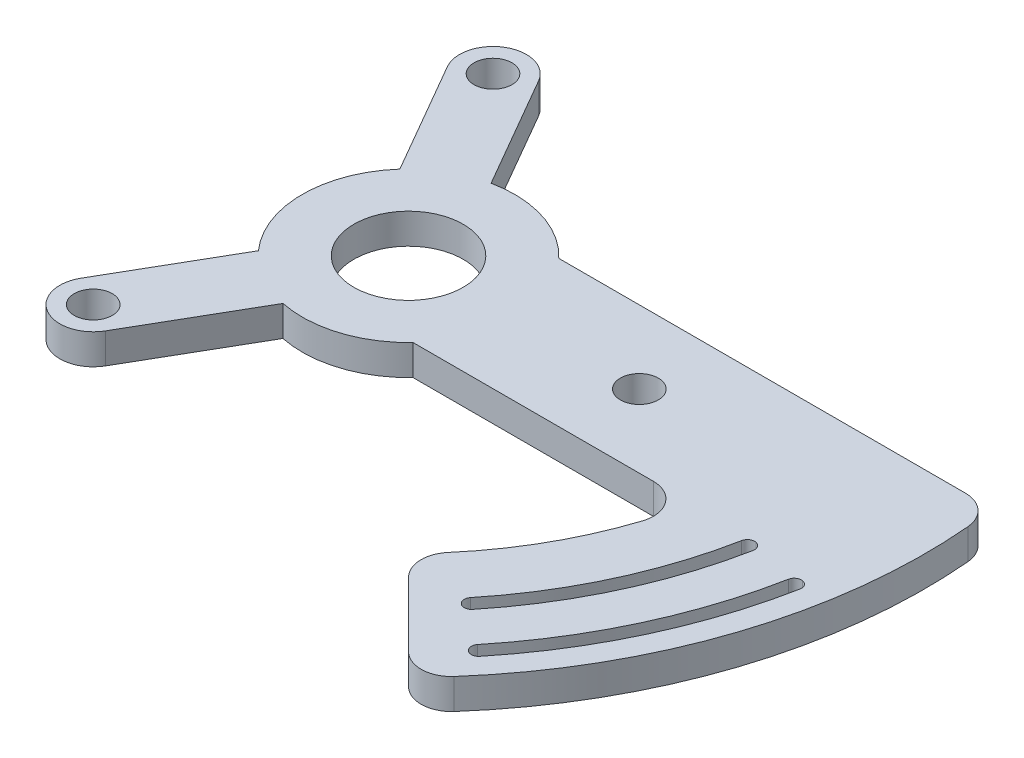
from build123d import *

# Parameters (mm, degrees)
SKETCH1_R               = 17.5
SKETCH1_R_2             = 9
BOSS_EXTRUDE1_DEPTH     = 5
BOSS_EXTRUDE3_DEPTH     = 5
SKETCH6_W               = 47.262260797
SKETCH6_H               = 24
BOSS_EXTRUDE4_DEPTH     = 5
SKETCH4_R               = 3.125
CUT_EXTRUDE1_DEPTH      = 63.69968102
CIRPATTERN1_COUNT       = 3
BOSS_EXTRUDE5_DEPTH     = 5
CUT_EXTRUDE_THIN1_DEPTH = 10
FILLET1_R               = 1.2
FILLET2_R               = 5


with BuildPart() as part:
    # Sketch1 → Boss-Extrude1 (new body)
    with BuildSketch(Plane(origin=(0, 0, 0), x_dir=(1, 0, 0), z_dir=(0, 1, 0))):
        with Locations(Location((0, 0, 0), (0, 0, 270))):
            Circle(SKETCH1_R)
        with Locations(Location((0, 0, 0), (0, 0, 270))):
            Circle(SKETCH1_R_2, mode=Mode.SUBTRACT)
    extrude(amount=BOSS_EXTRUDE1_DEPTH)

    # Sketch3 → Boss-Extrude3 (add)
    with BuildSketch(Plane(origin=(0, 0, 0), x_dir=(1, 0, 0), z_dir=(0, 1, 0))):
        with BuildLine():
            Line((38, 5.5), (10.009906254, 5.5))
            Line((10.009906254, 5.5), (10.009906254, -5.5))
            Line((10.009906254, -5.5), (38, -5.5))
            ThreePointArc((38, -5.5), (32.5, 0), (38, 5.5))
        make_face()
        with BuildLine():
            ThreePointArc((43.5, 0), (41.889087297, 3.889087297), (38, 5.5))
            Line((38, 5.5), (38, -5.5))
            ThreePointArc((38, -5.5), (41.889087297, -3.889087297), (43.5, 0))
        make_face()
        with BuildLine():
            Line((38, -5.5), (38, 5.5))
            ThreePointArc((38, 5.5), (32.5, 0), (38, -5.5))
        make_face()
    boss_extrude3 = extrude(amount=BOSS_EXTRUDE3_DEPTH)

    # Sketch6 → Boss-Extrude4 (add)
    with BuildSketch(Plane(origin=(0, 0, 0), x_dir=(1, 0, 0), z_dir=(0, 1, 0))):
        with Locations((36.368869602, 0)):
            Rectangle(SKETCH6_W, SKETCH6_H)
    extrude(amount=BOSS_EXTRUDE4_DEPTH)

    # Sketch4 → Cut-Extrude1 (cut, symmetric)
    with BuildSketch(Plane(origin=(0, 5, 0), x_dir=(1, 0, 0), z_dir=(0, 1, 0))):
        with Locations(Location((38, 0, 0), (0, 0, 270))):
            Circle(SKETCH4_R)
    cut_extrude1 = extrude(amount=CUT_EXTRUDE1_DEPTH, both=True, mode=Mode.SUBTRACT)

    # CirPattern1: Boss-Extrude3, Cut-Extrude1 ×3 about axis
    cirpattern1_axis = Axis((0, 0, 0), (0, 1, 0))
    add([boss_extrude3.rotate(cirpattern1_axis, i * 360 / CIRPATTERN1_COUNT) for i in range(1, CIRPATTERN1_COUNT)])
    add([cut_extrude1.rotate(cirpattern1_axis, i * 360 / CIRPATTERN1_COUNT) for i in range(1, CIRPATTERN1_COUNT)], mode=Mode.SUBTRACT)

    # Sketch7 → Boss-Extrude5 (add)
    with BuildSketch(Plane(origin=(0, 0, 0), x_dir=(1, 0, 0), z_dir=(0, 1, 0))):
        with BuildLine():
            Line((42.426406871, -42.426406871), (60.104076401, -60.104076401))
            ThreePointArc((60.104076401, -60.104076401), (78.529760263, -32.528091751), (85, 0))
            ThreePointArc((85, 0), (84.786902365, 6.015079992), (84.148677946, 12))
            Line((84.148677946, 12), (58.787753827, 12))
            ThreePointArc((58.787753827, 12), (59.69616918, 6.03053772), (60, 0))
            ThreePointArc((60, 0), (55.432771951, -22.961005942), (42.426406871, -42.426406871))
        make_face()
    extrude(amount=BOSS_EXTRUDE5_DEPTH)

    # Sketch8 → Cut-Extrude-Thin1 (cut)
    with BuildSketch(Plane(origin=(0, 5, 0), x_dir=(1, 0, 0), z_dir=(0, 1, 0))):
        with BuildLine():
            ThreePointArc((77.602850937, -13.6834764), (71.417053618, -33.302319025), (60.364302118, -50.651663643))
            Line((60.364302118, -50.651663643), (62.202808781, -52.194353907))
            ThreePointArc((62.202808781, -52.194353907), (73.592192307, -34.316602853), (79.966389545, -14.100232027))
            Line((79.966389545, -14.100232027), (77.602850937, -13.6834764))
        make_face()
        with BuildLine():
            ThreePointArc((68.247177284, -12.033818712), (62.807129642, -29.287445539), (53.086879908, -44.545181351))
            Line((53.086879908, -44.545181351), (54.925386572, -46.087871615))
            ThreePointArc((54.925386572, -46.087871615), (64.982268331, -30.301729367), (70.610715891, -12.450574339))
            Line((70.610715891, -12.450574339), (68.247177284, -12.033818712))
        make_face()
    extrude(amount=-CUT_EXTRUDE_THIN1_DEPTH, mode=Mode.SUBTRACT)

    # Fillet1
    fillet1_edges = [part.edges().sort_by_distance(p)[0] for p in [
        (70.610715891, 2.5, 12.450574339),
        (79.966389545, 2.5, 14.100232027),
        (77.602850937, 2.5, 13.6834764),
        (68.247177284, 2.5, 12.033818712),
        (62.202808781, 2.5, 52.194353907),
        (60.364302118, 2.5, 50.651663643),
        (54.925386572, 2.5, 46.087871615),
        (53.086879908, 2.5, 44.545181351),
    ]]
    fillet(fillet1_edges, radius=FILLET1_R - 0.0001)  # a hair under: the kernel refuses the full size

    # Fillet2
    fillet2_edges = [part.edges().sort_by_distance(p)[0] for p in [
        (84.148677946, 2.5, -12),
        (58.787753827, 2.5, 12),
        (42.426406871, 2.5, 42.426406871),
        (60.104076401, 2.5, 60.104076401),
    ]]
    fillet(fillet2_edges, radius=FILLET2_R)


solid = part.part
